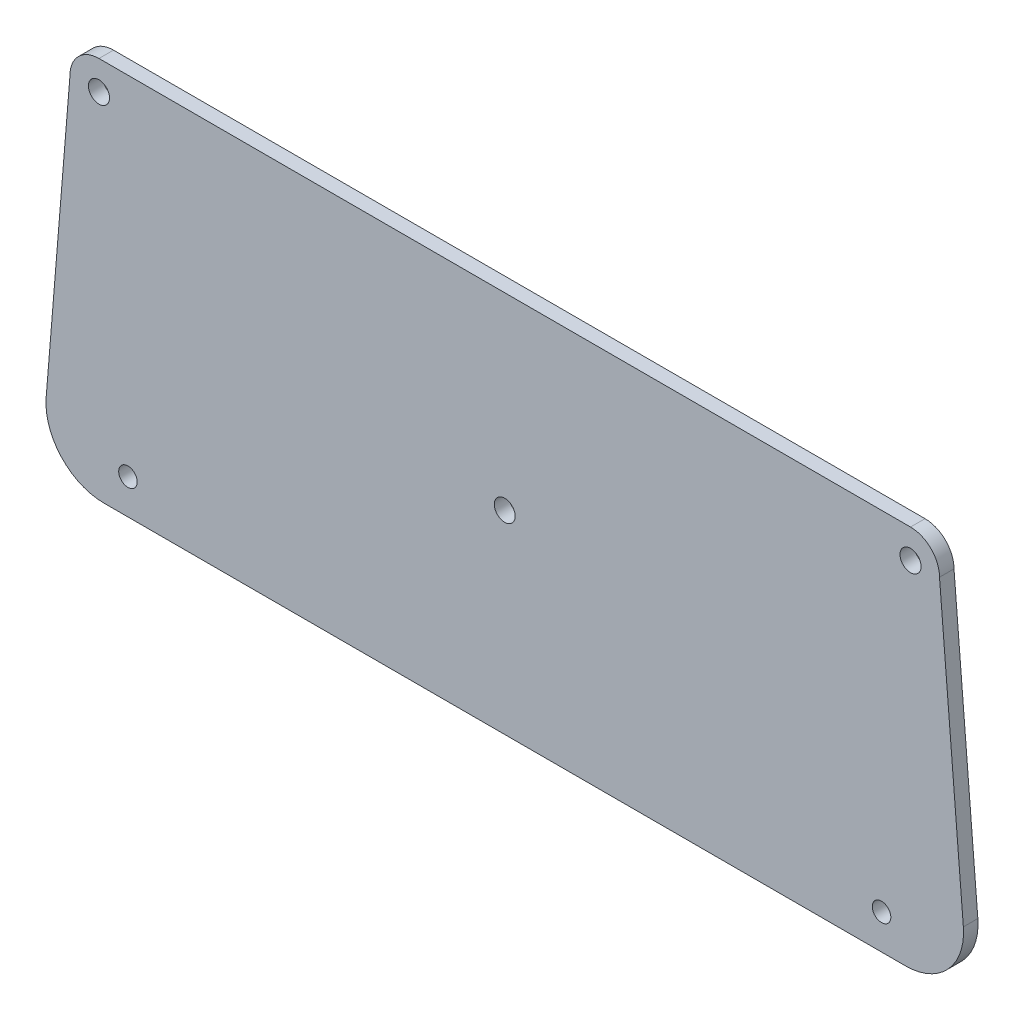
from build123d import *

# Parameters (mm, degrees)
SKETCH1_R           = 2.286
SKETCH1_R_2         = 2.3114
SKETCH1_R_3         = 2.032
BOSS_EXTRUDE1_DEPTH = 3.175
FILLET1_R           = 12.7


with BuildPart() as part:
    # Sketch1 → Boss-Extrude1 (new body)
    with BuildSketch(Plane.XY):
        with BuildLine():
            Line((-87.251790909, -38.047501058), (115.948209091, -38.047501058))
            Line((115.948209091, -38.047501058), (109.598209091, 39.422498942))
            ThreePointArc((109.598209091, 39.422498942), (107.738337152, 43.912627002), (103.248209091, 45.772498942))
            Line((103.248209091, 45.772498942), (-74.551790909, 45.772498942))
            ThreePointArc((-74.551790909, 45.772498942), (-79.041918969, 43.912627002), (-80.901790909, 39.422498942))
            Line((-80.901790909, 39.422498942), (-87.251790909, -38.047501058))
        make_face()
        with Locations((14.348209091, 4.497498942)):
            Circle(SKETCH1_R, mode=Mode.SUBTRACT)
        with Locations((-74.551790909, 39.422498942)):
            Circle(SKETCH1_R_2, mode=Mode.SUBTRACT)
        with Locations((103.248209091, 39.422498942)):
            Circle(SKETCH1_R_2, mode=Mode.SUBTRACT)
        with Locations((96.898209091, -30.427501058)):
            Circle(SKETCH1_R_3, mode=Mode.SUBTRACT)
        with Locations((-68.201790909, -30.400831058)):
            Circle(SKETCH1_R_3, mode=Mode.SUBTRACT)
    extrude(amount=BOSS_EXTRUDE1_DEPTH)

    # Fillet1
    fillet1_edges = [part.edges().sort_by_distance(p)[0] for p in [
        (-87.251790909, -38.047501058, 1.5875),
        (115.948209091, -38.047501058, 1.5875),
    ]]
    fillet(fillet1_edges, radius=FILLET1_R)


solid = part.part
